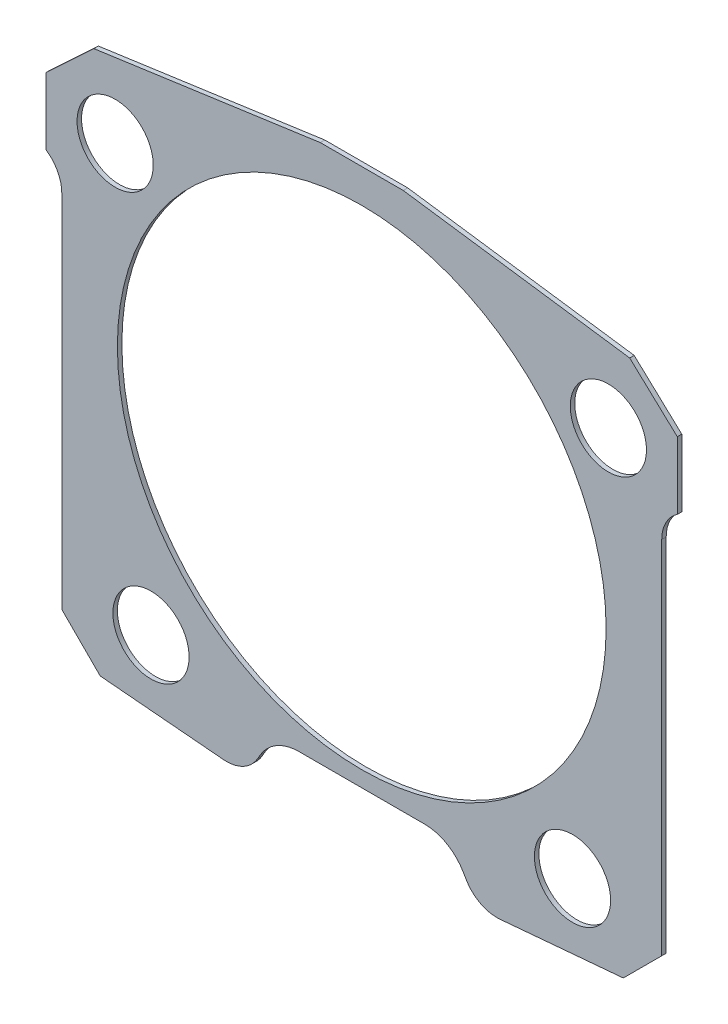
from build123d import *

# Parameters (mm, degrees)
SKETCH1_R           = 54.5
SKETCH1_R_2         = 8.5
BOSS_EXTRUDE1_DEPTH = 1


with BuildPart() as part:
    # Sketch1 → Boss-Extrude1 (new body)
    with BuildSketch(Plane.XY):
        with BuildLine():
            Line((-9.25, 62), (9.25, 62))
            Line((9.25, 62), (59.753671506, 54.902171851))
            Line((59.753671506, 54.902171851), (70.375, 44.997622795))
            Line((70.375, 44.997622795), (70.375, 30))
            ThreePointArc((70.375, 30), (67.821864652, 27.130969792), (66.9, 23.402699416))
            Line((66.9, 23.402699416), (66.9, -57))
            Line((66.9, -57), (58.333823358, -65.566176642))
            Line((58.333823358, -65.566176642), (30.863053479, -67.969557585))
            ThreePointArc((30.863053479, -67.969557585), (26.471818631, -67.096086665), (23.237604307, -64))
            Line((23.237604307, -64), (22.660254038, -63))
            ThreePointArc((22.660254038, -63), (19, -59.339745962), (14, -58))
            Line((14, -58), (-14, -58))
            ThreePointArc((-14, -58), (-19, -59.339745962), (-22.660254038, -63))
            Line((-22.660254038, -63), (-23.237604307, -64))
            ThreePointArc((-23.237604307, -64), (-26.471818631, -67.096086665), (-30.863053479, -67.969557585))
            Line((-30.863053479, -67.969557585), (-58.333823358, -65.566176642))
            Line((-58.333823358, -65.566176642), (-66.9, -57))
            Line((-66.9, -57), (-66.9, 23.402699416))
            ThreePointArc((-66.9, 23.402699416), (-67.821864652, 27.130969792), (-70.375, 30))
            Line((-70.375, 30), (-70.375, 44.997622795))
            Line((-70.375, 44.997622795), (-59.753671506, 54.902171851))
            Line((-59.753671506, 54.902171851), (-9.25, 62))
        make_face()
        Circle(SKETCH1_R, mode=Mode.SUBTRACT)
        with Locations((55, 39)):
            Circle(SKETCH1_R_2, mode=Mode.SUBTRACT)
        with Locations((-55, 39)):
            Circle(SKETCH1_R_2, mode=Mode.SUBTRACT)
        with Locations((47, -52)):
            Circle(SKETCH1_R_2, mode=Mode.SUBTRACT)
        with Locations((-47, -52)):
            Circle(SKETCH1_R_2, mode=Mode.SUBTRACT)
    extrude(amount=BOSS_EXTRUDE1_DEPTH)


solid = part.part
